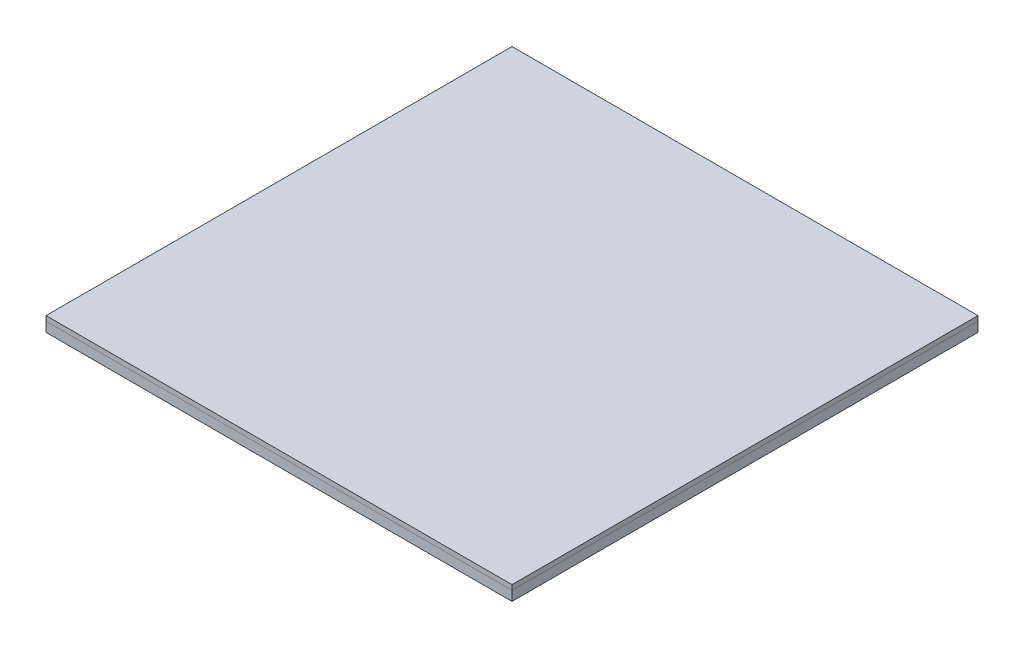
from build123d import *

# Parameters (mm, degrees)
RECTANGULAR_START                         = -152.4
RECTANGULAR_TUBE_1X1X0_060_1_OUTLINE_W    = 1.524
RECTANGULAR_TUBE_1X1X0_060_1_OUTLINE_H    = 1168.4
RECTANGULAR_TUBE_1X1X0_060_1_DEPTH        = 25.4
RECTANGULAR_TUBE_1X1X0_060_1_2_OUTLINE_W  = 22.352
RECTANGULAR_TUBE_1X1X0_060_1_2_OUTLINE_H  = 1168.4
RECTANGULAR_TUBE_1X1X0_060_1_2_DEPTH      = 1.524
RECTANGULAR_START_2                       = -128.524
RECTANGULAR_TUBE_1X1X0_060_1_3_OUTLINE_W  = 22.352
RECTANGULAR_TUBE_1X1X0_060_1_3_OUTLINE_H  = 1168.4
RECTANGULAR_TUBE_1X1X0_060_1_3_DEPTH      = 1.524
RECTANGULAR_START_3                       = 127
RECTANGULAR_TUBE_1X1X0_060_1_4_OUTLINE_W  = 1.524
RECTANGULAR_TUBE_1X1X0_060_1_4_OUTLINE_H  = 1168.4
RECTANGULAR_TUBE_1X1X0_060_1_4_DEPTH      = 25.4
RECTANGULAR_TUBE_1X1X0_060_1_5_OUTLINE_W  = 22.352
RECTANGULAR_TUBE_1X1X0_060_1_5_OUTLINE_H  = 1168.4
RECTANGULAR_TUBE_1X1X0_060_1_5_DEPTH      = 1.524
RECTANGULAR_START_4                       = 150.876
RECTANGULAR_TUBE_1X1X0_060_1_6_OUTLINE_W  = 22.352
RECTANGULAR_TUBE_1X1X0_060_1_6_OUTLINE_H  = 1168.4
RECTANGULAR_TUBE_1X1X0_060_1_6_DEPTH      = 1.524
RECTANGULAR_START_5                       = -12.7
RECTANGULAR_TUBE_1X1X0_060_1_7_DEPTH      = 25.4
RECTANGULAR_TUBE_1X1X0_060_1_8_DEPTH      = 1.524
RECTANGULAR_START_6                       = 11.176
RECTANGULAR_TUBE_1X1X0_060_1_9_DEPTH      = 1.524
RECTANGULAR_TUBE_1X1X0_060_1_10_DEPTH     = 25.4
RECTANGULAR_TUBE_1X1X0_060_1_11_DEPTH     = 1.524
RECTANGULAR_TUBE_1X1X0_060_1_12_DEPTH     = 1.524
RECTANGULAR_TUBE_1X1X0_060_1_13_DEPTH     = 25.4
RECTANGULAR_TUBE_1X1X0_060_1_14_DEPTH     = 1.524
RECTANGULAR_TUBE_1X1X0_060_1_15_DEPTH     = 1.524
RECTANGULAR_TUBE_1X1X0_060_1_16_DEPTH     = 25.4
RECTANGULAR_TUBE_1X1X0_060_1_17_DEPTH     = 1.524
RECTANGULAR_TUBE_1X1X0_060_1_18_DEPTH     = 1.524
RECTANGULAR_START_7                       = -304.8
RECTANGULAR_TUBE_1X1X0_060_1_19_OUTLINE_W = 431.8
RECTANGULAR_TUBE_1X1X0_060_1_19_OUTLINE_H = 1.524
RECTANGULAR_TUBE_1X1X0_060_1_19_DEPTH     = 25.4
RECTANGULAR_TUBE_1X1X0_060_1_20_OUTLINE_W = 431.8
RECTANGULAR_TUBE_1X1X0_060_1_20_OUTLINE_H = 22.352
RECTANGULAR_TUBE_1X1X0_060_1_20_DEPTH     = 1.524
RECTANGULAR_START_8                       = -280.924
RECTANGULAR_TUBE_1X1X0_060_1_21_OUTLINE_W = 431.8
RECTANGULAR_TUBE_1X1X0_060_1_21_OUTLINE_H = 22.352
RECTANGULAR_TUBE_1X1X0_060_1_21_DEPTH     = 1.524
RECTANGULAR_TUBE_1X1X0_060_1_22_OUTLINE_W = 431.8
RECTANGULAR_TUBE_1X1X0_060_1_22_OUTLINE_H = 1.524
RECTANGULAR_TUBE_1X1X0_060_1_22_DEPTH     = 25.4
RECTANGULAR_TUBE_1X1X0_060_1_23_OUTLINE_W = 431.8
RECTANGULAR_TUBE_1X1X0_060_1_23_OUTLINE_H = 22.352
RECTANGULAR_TUBE_1X1X0_060_1_23_DEPTH     = 1.524
RECTANGULAR_TUBE_1X1X0_060_1_24_OUTLINE_W = 431.8
RECTANGULAR_TUBE_1X1X0_060_1_24_OUTLINE_H = 22.352
RECTANGULAR_TUBE_1X1X0_060_1_24_DEPTH     = 1.524
RECTANGULAR_TUBE_1X1X0_060_1_25_OUTLINE_W = 254
RECTANGULAR_TUBE_1X1X0_060_1_25_OUTLINE_H = 1.524
RECTANGULAR_TUBE_1X1X0_060_1_25_DEPTH     = 25.4
RECTANGULAR_TUBE_1X1X0_060_1_26_OUTLINE_W = 254
RECTANGULAR_TUBE_1X1X0_060_1_26_OUTLINE_H = 22.352
RECTANGULAR_TUBE_1X1X0_060_1_26_DEPTH     = 1.524
RECTANGULAR_TUBE_1X1X0_060_1_27_OUTLINE_W = 254
RECTANGULAR_TUBE_1X1X0_060_1_27_OUTLINE_H = 22.352
RECTANGULAR_TUBE_1X1X0_060_1_27_DEPTH     = 1.524
RECTANGULAR_START_9                       = 279.4
RECTANGULAR_TUBE_1X1X0_060_1_28_OUTLINE_W = 431.8
RECTANGULAR_TUBE_1X1X0_060_1_28_OUTLINE_H = 1.524
RECTANGULAR_TUBE_1X1X0_060_1_28_DEPTH     = 25.4
RECTANGULAR_TUBE_1X1X0_060_1_29_OUTLINE_W = 431.8
RECTANGULAR_TUBE_1X1X0_060_1_29_OUTLINE_H = 22.352
RECTANGULAR_TUBE_1X1X0_060_1_29_DEPTH     = 1.524
RECTANGULAR_START_10                      = 303.276
RECTANGULAR_TUBE_1X1X0_060_1_30_OUTLINE_W = 431.8
RECTANGULAR_TUBE_1X1X0_060_1_30_OUTLINE_H = 22.352
RECTANGULAR_TUBE_1X1X0_060_1_30_DEPTH     = 1.524
RECTANGULAR_TUBE_1X1X0_060_1_31_OUTLINE_W = 431.8
RECTANGULAR_TUBE_1X1X0_060_1_31_OUTLINE_H = 1.524
RECTANGULAR_TUBE_1X1X0_060_1_31_DEPTH     = 25.4
RECTANGULAR_TUBE_1X1X0_060_1_32_OUTLINE_W = 431.8
RECTANGULAR_TUBE_1X1X0_060_1_32_OUTLINE_H = 22.352
RECTANGULAR_TUBE_1X1X0_060_1_32_DEPTH     = 1.524
RECTANGULAR_TUBE_1X1X0_060_1_33_OUTLINE_W = 431.8
RECTANGULAR_TUBE_1X1X0_060_1_33_OUTLINE_H = 22.352
RECTANGULAR_TUBE_1X1X0_060_1_33_DEPTH     = 1.524
RECTANGULAR_TUBE_1X1X0_060_1_34_OUTLINE_W = 254
RECTANGULAR_TUBE_1X1X0_060_1_34_OUTLINE_H = 1.524
RECTANGULAR_TUBE_1X1X0_060_1_34_DEPTH     = 25.4
RECTANGULAR_TUBE_1X1X0_060_1_35_OUTLINE_W = 254
RECTANGULAR_TUBE_1X1X0_060_1_35_OUTLINE_H = 22.352
RECTANGULAR_TUBE_1X1X0_060_1_35_DEPTH     = 1.524
RECTANGULAR_TUBE_1X1X0_060_1_36_OUTLINE_W = 254
RECTANGULAR_TUBE_1X1X0_060_1_36_OUTLINE_H = 22.352
RECTANGULAR_TUBE_1X1X0_060_1_36_DEPTH     = 1.524
SKETCH3_W                                 = 1219.2
SKETCH3_H                                 = 1219.2
BOSS_EXTRUDE1_DEPTH                       = 12.7


# Read off the part's stored shape, not the designer's step: Rectangular tube 1X1X0_060(1)
with BuildPart() as part:
    # Rectangular tube 1X1X0_060(1) outline → Rectangular tube 1X1X0_060(1) (new body)
    with BuildSketch(Plane.YZ.offset(RECTANGULAR_START)):
        with Locations((11.938, 0)):
            Rectangle(RECTANGULAR_TUBE_1X1X0_060_1_OUTLINE_W, RECTANGULAR_TUBE_1X1X0_060_1_OUTLINE_H)
        with Locations((-11.938, 0)):
            Rectangle(RECTANGULAR_TUBE_1X1X0_060_1_OUTLINE_W, RECTANGULAR_TUBE_1X1X0_060_1_OUTLINE_H)
    extrude(amount=RECTANGULAR_TUBE_1X1X0_060_1_DEPTH)

    # Rectangular tube 1X1X0_060_1 2 outline → Rectangular tube 1X1X0_060_1 2 (add)
    with BuildSketch(Plane.YZ.offset(RECTANGULAR_START)):
        Rectangle(RECTANGULAR_TUBE_1X1X0_060_1_2_OUTLINE_W, RECTANGULAR_TUBE_1X1X0_060_1_2_OUTLINE_H)
    extrude(amount=RECTANGULAR_TUBE_1X1X0_060_1_2_DEPTH)

    # Rectangular tube 1X1X0_060_1 3 outline → Rectangular tube 1X1X0_060_1 3 (add)
    with BuildSketch(Plane.YZ.offset(RECTANGULAR_START_2)):
        Rectangle(RECTANGULAR_TUBE_1X1X0_060_1_3_OUTLINE_W, RECTANGULAR_TUBE_1X1X0_060_1_3_OUTLINE_H)
    extrude(amount=RECTANGULAR_TUBE_1X1X0_060_1_3_DEPTH)


with BuildPart() as body_2:
    # Rectangular tube 1X1X0_060_1 4 outline → Rectangular tube 1X1X0_060_1 4 (new body)
    with BuildSketch(Plane.YZ.offset(RECTANGULAR_START_3)):
        with Locations((11.938, 0)):
            Rectangle(RECTANGULAR_TUBE_1X1X0_060_1_4_OUTLINE_W, RECTANGULAR_TUBE_1X1X0_060_1_4_OUTLINE_H)
        with Locations((-11.938, 0)):
            Rectangle(RECTANGULAR_TUBE_1X1X0_060_1_4_OUTLINE_W, RECTANGULAR_TUBE_1X1X0_060_1_4_OUTLINE_H)
    extrude(amount=RECTANGULAR_TUBE_1X1X0_060_1_4_DEPTH)

    # Rectangular tube 1X1X0_060_1 5 outline → Rectangular tube 1X1X0_060_1 5 (add)
    with BuildSketch(Plane.YZ.offset(RECTANGULAR_START_3)):
        Rectangle(RECTANGULAR_TUBE_1X1X0_060_1_5_OUTLINE_W, RECTANGULAR_TUBE_1X1X0_060_1_5_OUTLINE_H)
    extrude(amount=RECTANGULAR_TUBE_1X1X0_060_1_5_DEPTH)

    # Rectangular tube 1X1X0_060_1 6 outline → Rectangular tube 1X1X0_060_1 6 (add)
    with BuildSketch(Plane.YZ.offset(RECTANGULAR_START_4)):
        Rectangle(RECTANGULAR_TUBE_1X1X0_060_1_6_OUTLINE_W, RECTANGULAR_TUBE_1X1X0_060_1_6_OUTLINE_H)
    extrude(amount=RECTANGULAR_TUBE_1X1X0_060_1_6_DEPTH)


with BuildPart() as body_3:
    # Rectangular tube 1X1X0_060_1 7 outline → Rectangular tube 1X1X0_060_1 7 (new body)
    with BuildSketch(Plane(origin=(0, 0, 0), x_dir=(1, 0, 0), z_dir=(0, 1, 0)).offset(RECTANGULAR_START_5)):
        Polygon((-584.2, -584.2), (-584.2, 584.2), (-585.724, 585.724), (-585.724, -585.724), align=None)
        Polygon((-608.076, -608.076), (-608.076, 608.076), (-609.6, 609.6), (-609.6, -609.6), align=None)
    extrude(amount=RECTANGULAR_TUBE_1X1X0_060_1_7_DEPTH)

    # Rectangular tube 1X1X0_060_1 8 outline → Rectangular tube 1X1X0_060_1 8 (add)
    with BuildSketch(Plane(origin=(0, 0, 0), x_dir=(1, 0, 0), z_dir=(0, 1, 0)).offset(RECTANGULAR_START_5)):
        Polygon((-585.724, -585.724), (-585.724, 585.724), (-608.076, 608.076), (-608.076, -608.076), align=None)
    extrude(amount=RECTANGULAR_TUBE_1X1X0_060_1_8_DEPTH)

    # Rectangular tube 1X1X0_060_1 9 outline → Rectangular tube 1X1X0_060_1 9 (add)
    with BuildSketch(Plane(origin=(0, 0, 0), x_dir=(1, 0, 0), z_dir=(0, 1, 0)).offset(RECTANGULAR_START_6)):
        Polygon((-585.724, -585.724), (-585.724, 585.724), (-608.076, 608.076), (-608.076, -608.076), align=None)
    extrude(amount=RECTANGULAR_TUBE_1X1X0_060_1_9_DEPTH)


with BuildPart() as body_4:
    # Rectangular tube 1X1X0_060_1 10 outline → Rectangular tube 1X1X0_060_1 10 (new body)
    with BuildSketch(Plane(origin=(0, 0, 0), x_dir=(1, 0, 0), z_dir=(0, 1, 0)).offset(RECTANGULAR_START_5)):
        Polygon((-584.2, 584.2), (584.2, 584.2), (585.724, 585.724), (-585.724, 585.724), align=None)
        Polygon((-608.076, 608.076), (608.076, 608.076), (609.6, 609.6), (-609.6, 609.6), align=None)
    extrude(amount=RECTANGULAR_TUBE_1X1X0_060_1_10_DEPTH)

    # Rectangular tube 1X1X0_060_1 11 outline → Rectangular tube 1X1X0_060_1 11 (add)
    with BuildSketch(Plane(origin=(0, 0, 0), x_dir=(1, 0, 0), z_dir=(0, 1, 0)).offset(RECTANGULAR_START_5)):
        Polygon((-585.724, 585.724), (585.724, 585.724), (608.076, 608.076), (-608.076, 608.076), align=None)
    extrude(amount=RECTANGULAR_TUBE_1X1X0_060_1_11_DEPTH)

    # Rectangular tube 1X1X0_060_1 12 outline → Rectangular tube 1X1X0_060_1 12 (add)
    with BuildSketch(Plane(origin=(0, 0, 0), x_dir=(1, 0, 0), z_dir=(0, 1, 0)).offset(RECTANGULAR_START_6)):
        Polygon((-585.724, 585.724), (585.724, 585.724), (608.076, 608.076), (-608.076, 608.076), align=None)
    extrude(amount=RECTANGULAR_TUBE_1X1X0_060_1_12_DEPTH)


with BuildPart() as body_5:
    # Rectangular tube 1X1X0_060_1 13 outline → Rectangular tube 1X1X0_060_1 13 (new body)
    with BuildSketch(Plane(origin=(0, 0, 0), x_dir=(1, 0, 0), z_dir=(0, 1, 0)).offset(RECTANGULAR_START_5)):
        Polygon((584.2, -584.2), (-584.2, -584.2), (-585.724, -585.724), (585.724, -585.724), align=None)
        Polygon((608.076, -608.076), (-608.076, -608.076), (-609.6, -609.6), (609.6, -609.6), align=None)
    extrude(amount=RECTANGULAR_TUBE_1X1X0_060_1_13_DEPTH)

    # Rectangular tube 1X1X0_060_1 14 outline → Rectangular tube 1X1X0_060_1 14 (add)
    with BuildSketch(Plane(origin=(0, 0, 0), x_dir=(1, 0, 0), z_dir=(0, 1, 0)).offset(RECTANGULAR_START_5)):
        Polygon((585.724, -585.724), (-585.724, -585.724), (-608.076, -608.076), (608.076, -608.076), align=None)
    extrude(amount=RECTANGULAR_TUBE_1X1X0_060_1_14_DEPTH)

    # Rectangular tube 1X1X0_060_1 15 outline → Rectangular tube 1X1X0_060_1 15 (add)
    with BuildSketch(Plane(origin=(0, 0, 0), x_dir=(1, 0, 0), z_dir=(0, 1, 0)).offset(RECTANGULAR_START_6)):
        Polygon((585.724, -585.724), (-585.724, -585.724), (-608.076, -608.076), (608.076, -608.076), align=None)
    extrude(amount=RECTANGULAR_TUBE_1X1X0_060_1_15_DEPTH)


with BuildPart() as body_6:
    # Rectangular tube 1X1X0_060_1 16 outline → Rectangular tube 1X1X0_060_1 16 (new body)
    with BuildSketch(Plane(origin=(0, 0, 0), x_dir=(1, 0, 0), z_dir=(0, 1, 0)).offset(RECTANGULAR_START_5)):
        Polygon((584.2, 584.2), (584.2, -584.2), (585.724, -585.724), (585.724, 585.724), align=None)
        Polygon((608.076, 608.076), (608.076, -608.076), (609.6, -609.6), (609.6, 609.6), align=None)
    extrude(amount=RECTANGULAR_TUBE_1X1X0_060_1_16_DEPTH)

    # Rectangular tube 1X1X0_060_1 17 outline → Rectangular tube 1X1X0_060_1 17 (add)
    with BuildSketch(Plane(origin=(0, 0, 0), x_dir=(1, 0, 0), z_dir=(0, 1, 0)).offset(RECTANGULAR_START_5)):
        Polygon((585.724, 585.724), (585.724, -585.724), (608.076, -608.076), (608.076, 608.076), align=None)
    extrude(amount=RECTANGULAR_TUBE_1X1X0_060_1_17_DEPTH)

    # Rectangular tube 1X1X0_060_1 18 outline → Rectangular tube 1X1X0_060_1 18 (add)
    with BuildSketch(Plane(origin=(0, 0, 0), x_dir=(1, 0, 0), z_dir=(0, 1, 0)).offset(RECTANGULAR_START_6)):
        Polygon((585.724, 585.724), (585.724, -585.724), (608.076, -608.076), (608.076, 608.076), align=None)
    extrude(amount=RECTANGULAR_TUBE_1X1X0_060_1_18_DEPTH)


with BuildPart() as body_7:
    # Rectangular tube 1X1X0_060_1 19 outline → Rectangular tube 1X1X0_060_1 19 (new body)
    with BuildSketch(Plane.XY.offset(RECTANGULAR_START_7)):
        with Locations((368.3, 11.938)):
            Rectangle(RECTANGULAR_TUBE_1X1X0_060_1_19_OUTLINE_W, RECTANGULAR_TUBE_1X1X0_060_1_19_OUTLINE_H)
        with Locations((368.3, -11.938)):
            Rectangle(RECTANGULAR_TUBE_1X1X0_060_1_19_OUTLINE_W, RECTANGULAR_TUBE_1X1X0_060_1_19_OUTLINE_H)
    extrude(amount=RECTANGULAR_TUBE_1X1X0_060_1_19_DEPTH)

    # Rectangular tube 1X1X0_060_1 20 outline → Rectangular tube 1X1X0_060_1 20 (add)
    with BuildSketch(Plane.XY.offset(RECTANGULAR_START_7)):
        with Locations((368.3, 0)):
            Rectangle(RECTANGULAR_TUBE_1X1X0_060_1_20_OUTLINE_W, RECTANGULAR_TUBE_1X1X0_060_1_20_OUTLINE_H)
    extrude(amount=RECTANGULAR_TUBE_1X1X0_060_1_20_DEPTH)

    # Rectangular tube 1X1X0_060_1 21 outline → Rectangular tube 1X1X0_060_1 21 (add)
    with BuildSketch(Plane.XY.offset(RECTANGULAR_START_8)):
        with Locations((368.3, 0)):
            Rectangle(RECTANGULAR_TUBE_1X1X0_060_1_21_OUTLINE_W, RECTANGULAR_TUBE_1X1X0_060_1_21_OUTLINE_H)
    extrude(amount=RECTANGULAR_TUBE_1X1X0_060_1_21_DEPTH)


with BuildPart() as body_8:
    # Rectangular tube 1X1X0_060_1 22 outline → Rectangular tube 1X1X0_060_1 22 (new body)
    with BuildSketch(Plane(origin=(0, 0, 0), x_dir=(1, 0, 0), z_dir=(0, 1, 0)).offset(RECTANGULAR_START_5)):
        with Locations((-368.3, 304.038)):
            Rectangle(RECTANGULAR_TUBE_1X1X0_060_1_22_OUTLINE_W, RECTANGULAR_TUBE_1X1X0_060_1_22_OUTLINE_H)
        with Locations((-368.3, 280.162)):
            Rectangle(RECTANGULAR_TUBE_1X1X0_060_1_22_OUTLINE_W, RECTANGULAR_TUBE_1X1X0_060_1_22_OUTLINE_H)
    extrude(amount=RECTANGULAR_TUBE_1X1X0_060_1_22_DEPTH)

    # Rectangular tube 1X1X0_060_1 23 outline → Rectangular tube 1X1X0_060_1 23 (add)
    with BuildSketch(Plane(origin=(0, 0, 0), x_dir=(1, 0, 0), z_dir=(0, 1, 0)).offset(RECTANGULAR_START_5)):
        with Locations((-368.3, 292.1)):
            Rectangle(RECTANGULAR_TUBE_1X1X0_060_1_23_OUTLINE_W, RECTANGULAR_TUBE_1X1X0_060_1_23_OUTLINE_H)
    extrude(amount=RECTANGULAR_TUBE_1X1X0_060_1_23_DEPTH)

    # Rectangular tube 1X1X0_060_1 24 outline → Rectangular tube 1X1X0_060_1 24 (add)
    with BuildSketch(Plane(origin=(0, 0, 0), x_dir=(1, 0, 0), z_dir=(0, 1, 0)).offset(RECTANGULAR_START_6)):
        with Locations((-368.3, 292.1)):
            Rectangle(RECTANGULAR_TUBE_1X1X0_060_1_24_OUTLINE_W, RECTANGULAR_TUBE_1X1X0_060_1_24_OUTLINE_H)
    extrude(amount=RECTANGULAR_TUBE_1X1X0_060_1_24_DEPTH)


with BuildPart() as body_9:
    # Rectangular tube 1X1X0_060_1 25 outline → Rectangular tube 1X1X0_060_1 25 (new body)
    with BuildSketch(Plane.XY.offset(RECTANGULAR_START_7)):
        with Locations((0, -11.938)):
            Rectangle(RECTANGULAR_TUBE_1X1X0_060_1_25_OUTLINE_W, RECTANGULAR_TUBE_1X1X0_060_1_25_OUTLINE_H)
        with Locations((0, 11.938)):
            Rectangle(RECTANGULAR_TUBE_1X1X0_060_1_25_OUTLINE_W, RECTANGULAR_TUBE_1X1X0_060_1_25_OUTLINE_H)
    extrude(amount=RECTANGULAR_TUBE_1X1X0_060_1_25_DEPTH)

    # Rectangular tube 1X1X0_060_1 26 outline → Rectangular tube 1X1X0_060_1 26 (add)
    with BuildSketch(Plane.XY.offset(RECTANGULAR_START_7)):
        Rectangle(RECTANGULAR_TUBE_1X1X0_060_1_26_OUTLINE_W, RECTANGULAR_TUBE_1X1X0_060_1_26_OUTLINE_H)
    extrude(amount=RECTANGULAR_TUBE_1X1X0_060_1_26_DEPTH)

    # Rectangular tube 1X1X0_060_1 27 outline → Rectangular tube 1X1X0_060_1 27 (add)
    with BuildSketch(Plane.XY.offset(RECTANGULAR_START_8)):
        Rectangle(RECTANGULAR_TUBE_1X1X0_060_1_27_OUTLINE_W, RECTANGULAR_TUBE_1X1X0_060_1_27_OUTLINE_H)
    extrude(amount=RECTANGULAR_TUBE_1X1X0_060_1_27_DEPTH)


with BuildPart() as body_10:
    # Rectangular tube 1X1X0_060_1 28 outline → Rectangular tube 1X1X0_060_1 28 (new body)
    with BuildSketch(Plane.XY.offset(RECTANGULAR_START_9)):
        with Locations((368.3, 11.938)):
            Rectangle(RECTANGULAR_TUBE_1X1X0_060_1_28_OUTLINE_W, RECTANGULAR_TUBE_1X1X0_060_1_28_OUTLINE_H)
        with Locations((368.3, -11.938)):
            Rectangle(RECTANGULAR_TUBE_1X1X0_060_1_28_OUTLINE_W, RECTANGULAR_TUBE_1X1X0_060_1_28_OUTLINE_H)
    extrude(amount=RECTANGULAR_TUBE_1X1X0_060_1_28_DEPTH)

    # Rectangular tube 1X1X0_060_1 29 outline → Rectangular tube 1X1X0_060_1 29 (add)
    with BuildSketch(Plane.XY.offset(RECTANGULAR_START_9)):
        with Locations((368.3, 0)):
            Rectangle(RECTANGULAR_TUBE_1X1X0_060_1_29_OUTLINE_W, RECTANGULAR_TUBE_1X1X0_060_1_29_OUTLINE_H)
    extrude(amount=RECTANGULAR_TUBE_1X1X0_060_1_29_DEPTH)

    # Rectangular tube 1X1X0_060_1 30 outline → Rectangular tube 1X1X0_060_1 30 (add)
    with BuildSketch(Plane.XY.offset(RECTANGULAR_START_10)):
        with Locations((368.3, 0)):
            Rectangle(RECTANGULAR_TUBE_1X1X0_060_1_30_OUTLINE_W, RECTANGULAR_TUBE_1X1X0_060_1_30_OUTLINE_H)
    extrude(amount=RECTANGULAR_TUBE_1X1X0_060_1_30_DEPTH)


with BuildPart() as body_11:
    # Rectangular tube 1X1X0_060_1 31 outline → Rectangular tube 1X1X0_060_1 31 (new body)
    with BuildSketch(Plane(origin=(0, 0, 0), x_dir=(1, 0, 0), z_dir=(0, 1, 0)).offset(RECTANGULAR_START_5)):
        with Locations((-368.3, -280.162)):
            Rectangle(RECTANGULAR_TUBE_1X1X0_060_1_31_OUTLINE_W, RECTANGULAR_TUBE_1X1X0_060_1_31_OUTLINE_H)
        with Locations((-368.3, -304.038)):
            Rectangle(RECTANGULAR_TUBE_1X1X0_060_1_31_OUTLINE_W, RECTANGULAR_TUBE_1X1X0_060_1_31_OUTLINE_H)
    extrude(amount=RECTANGULAR_TUBE_1X1X0_060_1_31_DEPTH)

    # Rectangular tube 1X1X0_060_1 32 outline → Rectangular tube 1X1X0_060_1 32 (add)
    with BuildSketch(Plane(origin=(0, 0, 0), x_dir=(1, 0, 0), z_dir=(0, 1, 0)).offset(RECTANGULAR_START_5)):
        with Locations((-368.3, -292.1)):
            Rectangle(RECTANGULAR_TUBE_1X1X0_060_1_32_OUTLINE_W, RECTANGULAR_TUBE_1X1X0_060_1_32_OUTLINE_H)
    extrude(amount=RECTANGULAR_TUBE_1X1X0_060_1_32_DEPTH)

    # Rectangular tube 1X1X0_060_1 33 outline → Rectangular tube 1X1X0_060_1 33 (add)
    with BuildSketch(Plane(origin=(0, 0, 0), x_dir=(1, 0, 0), z_dir=(0, 1, 0)).offset(RECTANGULAR_START_6)):
        with Locations((-368.3, -292.1)):
            Rectangle(RECTANGULAR_TUBE_1X1X0_060_1_33_OUTLINE_W, RECTANGULAR_TUBE_1X1X0_060_1_33_OUTLINE_H)
    extrude(amount=RECTANGULAR_TUBE_1X1X0_060_1_33_DEPTH)


with BuildPart() as body_12:
    # Rectangular tube 1X1X0_060_1 34 outline → Rectangular tube 1X1X0_060_1 34 (new body)
    with BuildSketch(Plane.XY.offset(RECTANGULAR_START_9)):
        with Locations((0, -11.938)):
            Rectangle(RECTANGULAR_TUBE_1X1X0_060_1_34_OUTLINE_W, RECTANGULAR_TUBE_1X1X0_060_1_34_OUTLINE_H)
        with Locations((0, 11.938)):
            Rectangle(RECTANGULAR_TUBE_1X1X0_060_1_34_OUTLINE_W, RECTANGULAR_TUBE_1X1X0_060_1_34_OUTLINE_H)
    extrude(amount=RECTANGULAR_TUBE_1X1X0_060_1_34_DEPTH)

    # Rectangular tube 1X1X0_060_1 35 outline → Rectangular tube 1X1X0_060_1 35 (add)
    with BuildSketch(Plane.XY.offset(RECTANGULAR_START_9)):
        Rectangle(RECTANGULAR_TUBE_1X1X0_060_1_35_OUTLINE_W, RECTANGULAR_TUBE_1X1X0_060_1_35_OUTLINE_H)
    extrude(amount=RECTANGULAR_TUBE_1X1X0_060_1_35_DEPTH)

    # Rectangular tube 1X1X0_060_1 36 outline → Rectangular tube 1X1X0_060_1 36 (add)
    with BuildSketch(Plane.XY.offset(RECTANGULAR_START_10)):
        Rectangle(RECTANGULAR_TUBE_1X1X0_060_1_36_OUTLINE_W, RECTANGULAR_TUBE_1X1X0_060_1_36_OUTLINE_H)
    extrude(amount=RECTANGULAR_TUBE_1X1X0_060_1_36_DEPTH)


with BuildPart() as body_13:
    # Sketch3 → Boss-Extrude1 (new body)
    with BuildSketch(Plane(origin=(0, 12.7, 0), x_dir=(1, 0, 0), z_dir=(0, 1, 0))):
        Rectangle(SKETCH3_W, SKETCH3_H)
    extrude(amount=BOSS_EXTRUDE1_DEPTH)


solid = Compound([part.part, body_2.part, body_3.part, body_4.part, body_5.part, body_6.part, body_7.part, body_8.part, body_9.part, body_10.part, body_11.part, body_12.part, body_13.part])
